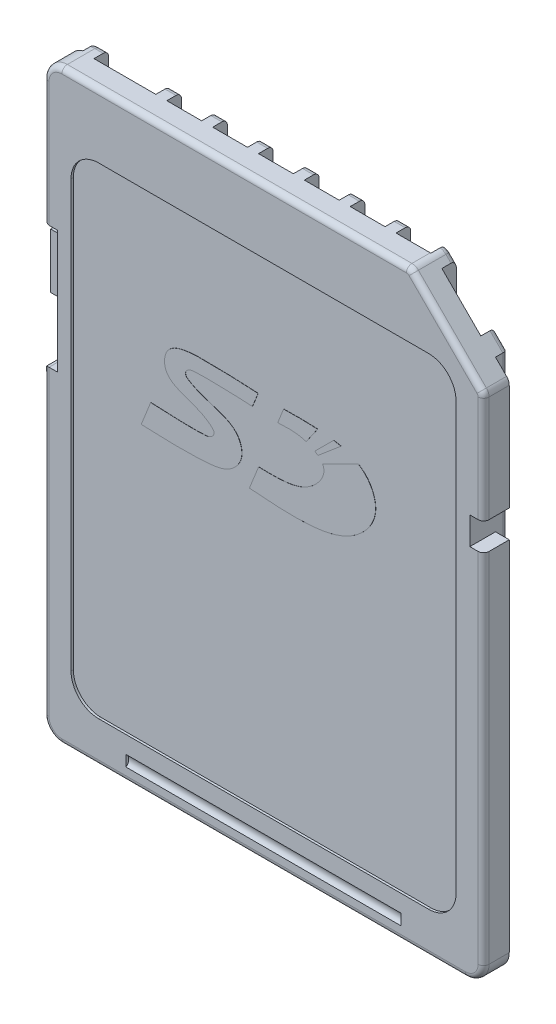
from build123d import *

# Parameters (mm, degrees)
SKETCH1_W              = 24
SKETCH1_H              = 32
MAIN_BODY_DEPTH        = 1.05
INDEX_CORNER_SIZE      = 4
SKETCH2_W              = 0.75
SKETCH2_H              = 1.5
SKETCH2_H_2            = 6.7
LOCK_TAB_CUTOUT_DEPTH  = 35.240473128
SKETCH3_W              = 0.75
SKETCH3_H              = 0.7
INDEXING_NOTCH_DEPTH   = 35.19214091
SKETCH4_W              = 1.9
SKETCH4_H              = 5.65
SKETCH4_W_2            = 2.125
SKETCH4_H_2            = 7.65
SKETCH4_W_3            = 3.375
CONTACT_CUTOUTS_DEPTH  = 0.8
DRAFT1_ANGLE           = 25
DRAFT2_ANGLE           = 25
FILLET3_R              = 0.5
FILLET1_R              = 1
FILLET4_R              = 0.3
LABEL_DEPTH            = 0.127
SKETCH6_W              = 0.65
SKETCH6_H              = 6.7
SLIDE_LOCK_NOTCH_DEPTH = 1
LOCK_SLIDE_TAB_DEPTH   = 3
CHAMFER2_SIZE          = 0.127
FILLET5_R              = 0.3
SKETCH8_W              = 1.4
SKETCH8_H              = 3.4
SKETCH8_H_2            = 3.6
SKETCH8_W_2            = 1.1
SKETCH8_W_3            = 0.9
CONTACT_PADS_DEPTH     = 0.1
SD_LOGO_DEPTH          = 0.01
SKETCH10_R             = 0.375
FINGER_GRAB_DEPTH      = 7.5


with BuildPart() as part:
    # Sketch1 → Main Body (new, symmetric)
    with BuildSketch(Plane.XY):
        with Locations((0, -16)):
            Rectangle(SKETCH1_W, SKETCH1_H)
    extrude(amount=MAIN_BODY_DEPTH, both=True)

    # Index Corner
    index_corner_edges = [part.edges().sort_by_distance(p)[0] for p in [
        (12, 0, 0),
    ]]
    chamfer(index_corner_edges, length=INDEX_CORNER_SIZE)

    # Sketch2 → Lock Tab Cutout (cut, through all)
    with BuildSketch(Plane.XY.offset(1.05)):
        with Locations((11.625, -10.75)):
            Rectangle(SKETCH2_W, SKETCH2_H)
        with Locations((-11.625, -11.15)):
            Rectangle(SKETCH2_W, SKETCH2_H_2)
    extrude(amount=-LOCK_TAB_CUTOUT_DEPTH, mode=Mode.SUBTRACT)

    # Sketch3 → Indexing Notch (cut, through all)
    with BuildSketch(Plane.XZ.offset(32)):
        with Locations((-11.625, -0.7)):
            Rectangle(SKETCH3_W, SKETCH3_H)
        with Locations((11.625, -0.7)):
            Rectangle(SKETCH3_W, SKETCH3_H)
    extrude(amount=-INDEXING_NOTCH_DEPTH, mode=Mode.SUBTRACT)

    # Sketch4 → Contact Cutouts (cut)
    with BuildSketch(Plane(origin=(0, 0, -1.05), x_dir=(-1, 0, 0), z_dir=(0, 0, -1))):
        with Locations((-6.875, -2.825)):
            Rectangle(SKETCH4_W, SKETCH4_H)
        with Locations((-4.375, -2.825)):
            Rectangle(SKETCH4_W, SKETCH4_H)
        with Locations((-1.875, -2.825)):
            Rectangle(SKETCH4_W, SKETCH4_H)
        with Locations((0.625, -2.825)):
            Rectangle(SKETCH4_W, SKETCH4_H)
        with Locations((-9.4875, -3.825)):
            Rectangle(SKETCH4_W_2, SKETCH4_H_2)
        with Locations((3.125, -2.825)):
            Rectangle(SKETCH4_W, SKETCH4_H)
        with Locations((5.625, -2.825)):
            Rectangle(SKETCH4_W, SKETCH4_H)
        with Locations((8.8625, -2.825)):
            Rectangle(SKETCH4_W_3, SKETCH4_H)
    extrude(amount=-CONTACT_CUTOUTS_DEPTH, mode=Mode.SUBTRACT)

    # Draft1
    draft1_faces = [part.faces().sort_by_distance(p)[0] for p in [
        (6.875, -5.65, -0.65),
        (4.375, -5.65, -0.65),
        (1.875, -5.65, -0.65),
        (-0.625, -5.65, -0.65),
        (-3.125, -5.65, -0.65),
        (-5.625, -5.65, -0.65),
        (-8.8625, -5.65, -0.65),
    ]]
    draft(draft1_faces, Plane(origin=(-7.175, 0, -0.25), x_dir=(-1, 0, 0), z_dir=(0, 0, -1)), DRAFT1_ANGLE)

    # Draft2
    draft2_faces = [part.faces().sort_by_distance(p)[0] for p in [
        (9.4875, -7.65, -0.65),
    ]]
    draft(draft2_faces, Plane(origin=(10.55, -7.65, -0.25), x_dir=(-1, 0, 0), z_dir=(0, 0, -1)), DRAFT2_ANGLE)

    # Fillet3
    fillet3_edges = [part.edges().sort_by_distance(p)[0] for p in [
        (11.25, -32, -0.7),
        (-11.25, -32, -0.7),
        (12, -4, 0.35),
        (8, 0, 0),
    ]]
    fillet(fillet3_edges, radius=FILLET3_R)

    # Fillet1
    fillet1_edges = [part.edges().sort_by_distance(p)[0] for p in [
        (12, -32, 0.35),
        (-12, -32, 0.35),
        (-12, 0, 0.35),
    ]]
    fillet(fillet1_edges, radius=FILLET1_R)

    # Fillet4
    fillet4_edges = [part.edges().sort_by_distance(p)[0] for p in [
        (5.625, 0, -1.05),
        (3.125, 0, -1.05),
        (0.625, 0, -1.05),
        (10.9, -2.9, -1.05),
        (-1.875, 0, -1.05),
        (-4.375, 0, -1.05),
        (-6.875, 0, -1.05),
        (-10.775, 0, -1.05),
        (12, -7.103553391, 1.05),
        (10, -2, 1.05),
        (-1.603553391, 0, 1.05),
        (7.984234935, -0.038060234, 1.05),
        (11.961939766, -4.015765065, 1.05),
        (8.285723305, -0.285723305, -1.05),
        (7.998975243, -0.044445174, -1.05),
        (12, -21.25, 1.05),
        (0, -32, 1.05),
        (-12, -4.4, 1.05),
        (-11.707106781, -0.292893219, 1.05),
        (-11.707106781, -31.707106781, 1.05),
        (11.707106781, -31.707106781, 1.05),
        (-11.126004292, -0.007970304, -1.05),
        (-12, -22.75, 1.05),
        (-12, -14.5, 0.35),
        (-12, -7.8, 0.35),
    ]]
    fillet(fillet4_edges, radius=FILLET4_R)

    # Sketch5 → Label (cut)
    with BuildSketch(Plane.XY.offset(1.05)):
        with BuildLine():
            Line((-9, -3.5), (9, -3.5))
            ThreePointArc((9, -3.5), (10.060660172, -3.939339828), (10.5, -5))
            Line((10.5, -5), (10.5, -28.25))
            ThreePointArc((10.5, -28.25), (10.060660172, -29.310660172), (9, -29.75))
            Line((9, -29.75), (-9, -29.75))
            ThreePointArc((-9, -29.75), (-10.060660172, -29.310660172), (-10.5, -28.25))
            Line((-10.5, -28.25), (-10.5, -5))
            ThreePointArc((-10.5, -5), (-10.060660172, -3.939339828), (-9, -3.5))
        make_face()
    extrude(amount=-LABEL_DEPTH, mode=Mode.SUBTRACT)

    # Sketch6 → Slide Lock Notch (cut)
    with BuildSketch(Plane.ZY.offset(11.25)):
        with Locations((-0.025, -11.15)):
            Rectangle(SKETCH6_W, SKETCH6_H)
    extrude(amount=-SLIDE_LOCK_NOTCH_DEPTH, mode=Mode.SUBTRACT)

    # Sketch7 → Lock Slide Tab (add)
    with BuildSketch(Plane.XZ.offset(8.054)):
        Polygon((-10.25, 0.3), (-11.377, 0.3), (-11.377, 0.923), (-11.873, 0.923), (-11.873, -0.35), (-10.25, -0.35), align=None)
    extrude(amount=LOCK_SLIDE_TAB_DEPTH)

    # Chamfer2
    chamfer2_edges = [part.edges().sort_by_distance(p)[0] for p in [
        (-11.873, -9.554, -0.35),
        (-11.873, -8.054, 0.2865),
        (-11.873, -9.554, 0.923),
        (-11.873, -11.054, 0.2865),
    ]]
    chamfer(chamfer2_edges, length=CHAMFER2_SIZE)

    # Fillet5
    # the kernel refuses this fillet: 0.3 mm, written as the material it takes off along each edge
    with BuildSketch(Plane(origin=(10.75, -32, -1.05), x_dir=(0, 1, 0), z_dir=(-1, 0, 0))) as fillet5_piece_1:
        with BuildLine():
            CenterArc((FILLET5_R, -FILLET5_R), FILLET5_R, 90, 90)
            Line((0, -FILLET5_R), (0, 0))
            Line((0, 0), (FILLET5_R, 0))
        make_face()
    extrude(amount=21.5, mode=Mode.SUBTRACT)
    with BuildSketch(Plane(origin=(-11.25, 0.403834842, -1.05), x_dir=(0, 0, 1), z_dir=(0, -1, 0))) as fillet5_piece_2:
        with BuildLine():
            CenterArc((FILLET5_R, -FILLET5_R), FILLET5_R, 90, 90)
            Line((0, -FILLET5_R), (0, 0))
            Line((0, 0), (FILLET5_R, 0))
        make_face()
    extrude(amount=31.903834842, mode=Mode.SUBTRACT)
    with BuildSketch(Plane(origin=(-10.75, -31.5, -1.05), x_dir=(-1, 0, 0), z_dir=(0, 1, 0))) as fillet5_piece_3:
        with BuildLine():
            CenterArc((0.5 - FILLET5_R, FILLET5_R), FILLET5_R, 270, 90)
            Line((0.5, FILLET5_R), (0.5, 0))
            Line((0.5, 0), (0.5 - FILLET5_R, 0))
        make_face()
    revolve(axis=Axis((-10.75, -31.5, -1.05), (0, 0, 1)), revolution_arc=90, mode=Mode.SUBTRACT)
    with BuildSketch(Plane(origin=(10.75, -31.5, -1.05), x_dir=(0, -1, 0), z_dir=(-1, 0, 0))) as fillet5_piece_4:
        with BuildLine():
            CenterArc((0.5 - FILLET5_R, FILLET5_R), FILLET5_R, 270, 90)
            Line((0.5, FILLET5_R), (0.5, 0))
            Line((0.5, 0), (0.5 - FILLET5_R, 0))
        make_face()
    revolve(axis=Axis((10.75, -31.5, -1.05), (0, 0, 1)), revolution_arc=90, mode=Mode.SUBTRACT)
    with BuildSketch(Plane(origin=(11.25, -2.924264069, -1.05), x_dir=(-1, 0, 0), z_dir=(0, -1, 0))) as fillet5_piece_5:
        with BuildLine():
            CenterArc((FILLET5_R, -FILLET5_R), FILLET5_R, 90, 90)
            Line((0, -FILLET5_R), (0, 0))
            Line((0, 0), (FILLET5_R, 0))
        make_face()
    extrude(amount=28.575735931, mode=Mode.SUBTRACT)

    # Sketch8 → Contact Pads (add)
    with BuildSketch(Plane(origin=(0, 0, -0.25), x_dir=(-1, 0, 0), z_dir=(0, 0, -1))):
        Polygon((-8.7875, -4), (-9.7375, -4), (-10.1875, -4.45), (-10.1875, -7), (-8.7875, -7), align=None)
        with Locations((-6.875, -3.3)):
            Rectangle(SKETCH8_W, SKETCH8_H)
        with Locations((-4.375, -3.3)):
            Rectangle(SKETCH8_W, SKETCH8_H)
        with Locations((-1.875, -3.2)):
            Rectangle(SKETCH8_W, SKETCH8_H_2)
        with Locations((0.625, -3.2)):
            Rectangle(SKETCH8_W, SKETCH8_H_2)
        with Locations((3.125, -3.3)):
            Rectangle(SKETCH8_W, SKETCH8_H)
        with Locations((5.625, -3.3)):
            Rectangle(SKETCH8_W, SKETCH8_H)
        with Locations((8.225, -3.3)):
            Rectangle(SKETCH8_W_2, SKETCH8_H)
        with Locations((9.475, -3.3)):
            Rectangle(SKETCH8_W_3, SKETCH8_H)
    extrude(amount=CONTACT_PADS_DEPTH)

    # Sketch9 → SD Logo (add)
    with BuildSketch(Plane.XY.offset(0.923)):
        with BuildLine():
            Line((-6.272359106, -13.513417195), (-6.788199911, -14.803019208))
            add(Edge.make_bspline(
                [(-6.788199911, -14.803019208), (-5.602585422, -14.85281834), (-4.011919117, -14.919630784), (-1.979172221, -14.692140202), (-1.13486057, -13.703813256), (-1.53980267, -12.352571905), (-2.421665508, -12.123355357), (-3.425136518, -11.781513584), (-3.873959264, -11.660347781), (-4.329244004, -11.332542768), (-4.417490683, -11.192966872), (-4.238104135, -10.881498471), (-3.40432398, -10.820289951), (-2.742221569, -10.858492296), (-1.752993938, -10.869607213), (-1.304225842, -10.892669966), (-0.724516624, -10.926114728)],
                knots=[0, 0, 0, 0, 0.256765986, 0.344487189, 0.429501529, 0.495962858, 0.609425785, 0.609425785, 0.712523439, 0.712523439, 0.728642679, 0.741600647, 0.78171585, 0.890530575, 0.890530575, 1, 1, 1, 1], degree=3))
            Line((-0.724516624, -10.926114728), (-0.415989675, -10.154797358))
            add(Edge.make_bspline(
                [(-0.415989675, -10.154797358), (-1.130860986, -10.115859284), (-1.845732296, -10.07692121), (-3.831726172, -10.056016011), (-5.45187088, -9.955401177), (-5.59856265, -12.321821224), (-3.69409156, -12.223001367), (-2.747297977, -13.198281294), (-2.968296908, -13.534068676), (-3.237080118, -13.575671252), (-4.198697738, -13.616302983), (-5.235528422, -13.564860089), (-6.272359106, -13.513417195)],
                knots=[0, 0, 0, 0, 0.184888017, 0.184888017, 0.410553983, 0.452270772, 0.688314255, 0.713033448, 0.734013231, 0.768579166, 0.768579166, 1, 1, 1, 1], degree=3))
        make_face()
        with BuildLine():
            Line((0.976941933, -10.198815063), (0.656862188, -10.999014425))
            add(Edge.make_bspline(
                [(2.205386373, -11.119276866), (1.683597535, -10.94822124), (1.170229862, -10.973617833), (0.656862188, -10.999014425)],
                knots=[0.780930462, 0.780930462, 0.780930462, 0.780930462, 1, 1, 1, 1], degree=3))
            Line((2.205386373, -11.119276866), (2.832275444, -10.21727824))
            add(Edge.make_bspline(
                [(2.832275444, -10.21727824), (2.190313495, -10.178970497), (1.583627714, -10.18889278), (0.976941933, -10.198815063)],
                knots=[0.867536525, 0.867536525, 0.867536525, 0.867536525, 1, 1, 1, 1], degree=3))
        make_face()
        with BuildLine():
            Line((2.67813862, -11.333690509), (3.710018807, -10.307511307))
            add(Edge.make_bspline(
                [(4.10849773, -10.386117793), (3.977762922, -10.354835119), (3.844464057, -10.329006946), (3.710018807, -10.307511307)],
                knots=[0.780592129, 0.780592129, 0.780592129, 0.780592129, 0.808002636, 0.808002636, 0.808002636, 0.808002636], degree=3))
            Line((4.10849773, -10.386117793), (2.848629207, -11.450795435))
            add(Edge.make_bspline(
                [(2.848629207, -11.450795435), (2.795544588, -11.409046999), (2.738150174, -11.369934132), (2.67813862, -11.333690509)],
                knots=[0.687306903, 0.687306903, 0.687306903, 0.687306903, 0.714100024, 0.714100024, 0.714100024, 0.714100024], degree=3))
        make_face()
        with BuildLine():
            Line((3.105690459, -11.737870017), (5.043155806, -10.755396459))
            add(Edge.make_bspline(
                [(-0.888513375, -14.862453332), (0.117379682, -14.941911633), (2.048000759, -15.094416782), (4.755030131, -14.670609383), (6.300555974, -12.750310408), (5.740372888, -11.296201547), (5.229350476, -10.870437247), (5.043155806, -10.755396459)],
                knots=[0, 0, 0, 0, 0.216183748, 0.414923731, 0.566248712, 0.66281642, 0.710015076, 0.710015076, 0.710015076, 0.710015076], degree=3))
            Line((-0.888513375, -14.862453332), (-0.388939839, -13.613519492))
            add(Edge.make_bspline(
                [(-0.388939839, -13.613519492), (0.068852835, -13.624135269), (1.065442516, -13.647245238), (2.471490505, -13.341167091), (3.306353955, -12.205447956), (3.128181157, -11.778704833), (3.105690459, -11.737870017)],
                knots=[0, 0, 0, 0, 0.191940552, 0.417844113, 0.611310702, 0.632535702, 0.632535702, 0.632535702, 0.632535702], degree=3))
        make_face()
    extrude(amount=SD_LOGO_DEPTH)

    # Sketch10 → Finger Grab (cut, symmetric)
    with BuildSketch(Plane(origin=(0, 0, 0), x_dir=(0, 0, -1), z_dir=(1, 0, 0))):
        with Locations((-1.276752605, -30.988002185)):
            Circle(SKETCH10_R)
    extrude(amount=FINGER_GRAB_DEPTH, both=True, mode=Mode.SUBTRACT)


solid = part.part
